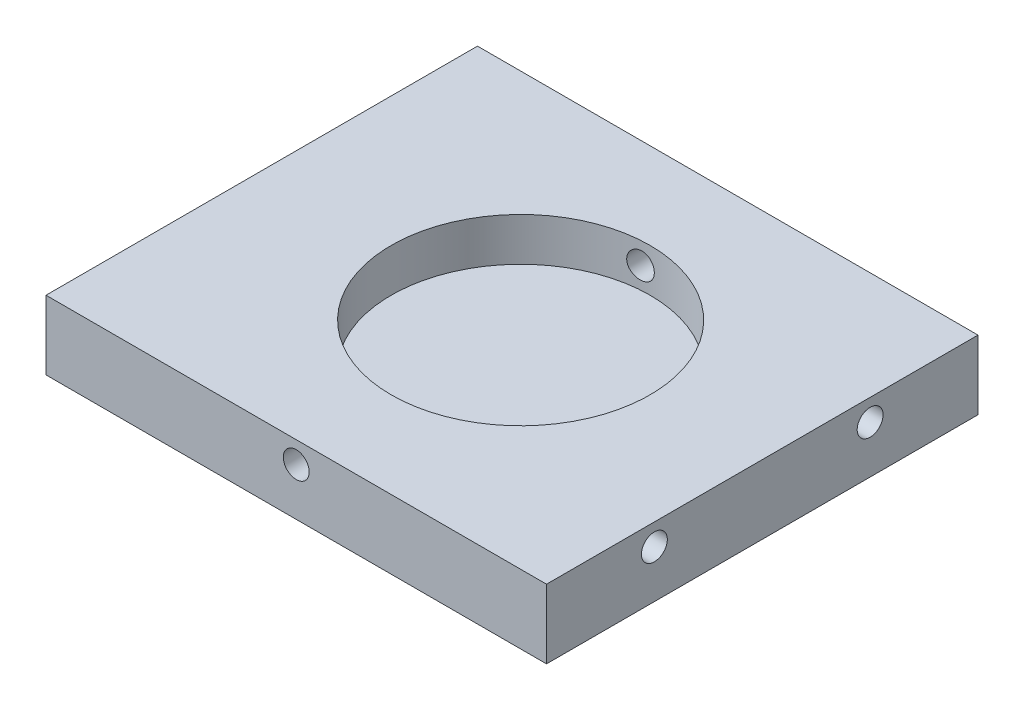
from build123d import *

# Parameters (mm, degrees)
ESQUISSE1_W             = 58
ESQUISSE1_H             = 8
BOSS_EXTRU_1_DEPTH      = 50
ESQUISSE2_R             = 15
ENL_V_MAT_EXTRU_1_DEPTH = 5
ESQUISSE3_R             = 1.5
ENL_V_MAT_EXTRU_2_DEPTH = 10
ENL_V_START             = -10
ESQUISSE4_R             = 1.5
ENL_V_MAT_EXTRU_3_DEPTH = 10
ESQUISSE5_R             = 1.5
ENL_V_MAT_EXTRU_4_DEPTH = 90.806736941


with BuildPart() as part:
    # Esquisse1 → Boss.-Extru.1 (new body)
    with BuildSketch(Plane.XY):
        with Locations((23.5, -49)):
            Rectangle(ESQUISSE1_W, ESQUISSE1_H)
    extrude(amount=BOSS_EXTRU_1_DEPTH)

    # Esquisse2 → Enlèv. mat.-Extru.1 (cut)
    with BuildSketch(Plane(origin=(0, -45, 0), x_dir=(-1, 0, 0), z_dir=(0, 1, 0))):
        with Locations((-24.5, 25)):
            Circle(ESQUISSE2_R)
    extrude(amount=-ENL_V_MAT_EXTRU_1_DEPTH, mode=Mode.SUBTRACT)

    # Esquisse3 → Enlèv. mat.-Extru.2 (cut)
    with BuildSketch(Plane.ZY.offset(5.5)):
        with Locations((12.5, -47.5)):
            Circle(ESQUISSE3_R)
        with Locations((37.5, -47.5)):
            Circle(ESQUISSE3_R)
    extrude(amount=-ENL_V_MAT_EXTRU_2_DEPTH, mode=Mode.SUBTRACT)

    # Esquisse4 → Enlèv. mat.-Extru.3 (cut)
    with BuildSketch(Plane(origin=(52.5, 0, 0), x_dir=(0, 0, -1), z_dir=(1, 0, 0)).offset(ENL_V_START)):
        with Locations((-37.5, -47.5)):
            Circle(ESQUISSE4_R)
        with Locations((-12.5, -47.5)):
            Circle(ESQUISSE4_R)
    extrude(amount=ENL_V_MAT_EXTRU_3_DEPTH, mode=Mode.SUBTRACT)

    # Esquisse5 → Enlèv. mat.-Extru.4 (cut, through all)
    with BuildSketch(Plane(origin=(0, 0, 0), x_dir=(-1, 0, 0), z_dir=(0, 0, -1))):
        with Locations((-23.5, -47.5)):
            Circle(ESQUISSE5_R)
    extrude(amount=-ENL_V_MAT_EXTRU_4_DEPTH, mode=Mode.SUBTRACT)


solid = part.part
